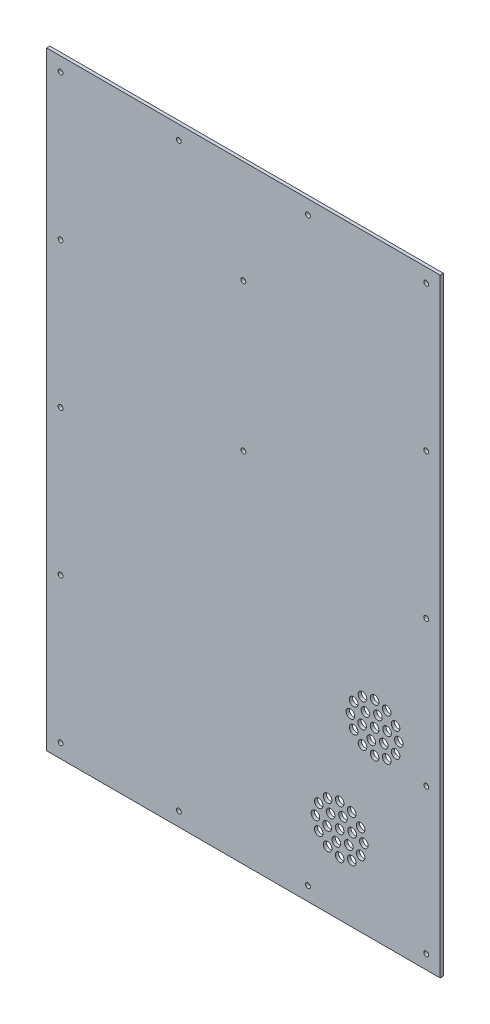
from build123d import *

# Parameters (mm, degrees)
SKETCH_1_W               = 366
SKETCH_1_H               = 566
EXTRUDE_1_DEPTH          = 3
SKETCH_5_R               = 2.25
CUT_EXTRUDE_2_DEPTH      = 675.033381963
CUT_EXTRUDE_5_DEPTH      = 675.033381963
CUT_EXTRUDE_5_DEPTH_BACK = 10
SKETCH_8_R               = 4
SKETCH_10_R              = 2.25
CUT_EXTRUDE_6_DEPTH      = 675.033381963


with BuildPart() as part:
    # Эскиз1 → Бобышка-Вытянуть1 (new body)
    with BuildSketch(Plane.XY):
        with Locations((183, 283)):
            Rectangle(SKETCH_1_W, SKETCH_1_H)
    extrude(amount=EXTRUDE_1_DEPTH)

    # Эскиз5 → Вырез-Вытянуть2 (cut, through all)
    with BuildSketch(Plane(origin=(0, 0, 0), x_dir=(-1, 0, 0), z_dir=(0, 0, -1))):
        with Locations((-353, 553)):
            Circle(SKETCH_5_R)
        with Locations((-13, 553)):
            Circle(SKETCH_5_R)
        with Locations((-243, 553)):
            Circle(SKETCH_5_R)
        with Locations((-123, 553)):
            Circle(SKETCH_5_R)
        with Locations((-353, 418)):
            Circle(SKETCH_5_R)
        with Locations((-353, 283)):
            Circle(SKETCH_5_R)
        with Locations((-353, 148)):
            Circle(SKETCH_5_R)
        with Locations((-353, 13)):
            Circle(SKETCH_5_R)
        with Locations((-123, 13)):
            Circle(SKETCH_5_R)
        with Locations((-243, 13)):
            Circle(SKETCH_5_R)
        with Locations((-13, 418)):
            Circle(SKETCH_5_R)
        with Locations((-13, 283)):
            Circle(SKETCH_5_R)
        with Locations((-13, 148)):
            Circle(SKETCH_5_R)
        with Locations((-13, 13)):
            Circle(SKETCH_5_R)
    extrude(amount=-CUT_EXTRUDE_2_DEPTH, mode=Mode.SUBTRACT)

    # Эскиз8 → Вырез-Вытянуть5 (cut, two sides: drawn at the far end of the back side and taken through both)
    with BuildSketch(Plane.XY.offset(-CUT_EXTRUDE_5_DEPTH_BACK)):
        with Locations((305, 148.5)):
            Circle(SKETCH_8_R)
        with Locations((313.485281374, 162.514718626)):
            Circle(SKETCH_8_R)
        with Locations((305, 171)):
            Circle(SKETCH_8_R)
        with Locations((293.75, 151.514428415)):
            Circle(SKETCH_8_R)
        with Locations((285.514428415, 159.75)):
            Circle(SKETCH_8_R)
        with Locations((282.5, 171)):
            Circle(SKETCH_8_R)
        with Locations((285.514428415, 182.25)):
            Circle(SKETCH_8_R)
        with Locations((293.75, 190.485571585)):
            Circle(SKETCH_8_R)
        with Locations((305, 193.5)):
            Circle(SKETCH_8_R)
        with Locations((316.25, 190.485571585)):
            Circle(SKETCH_8_R)
        with Locations((324.485571585, 182.25)):
            Circle(SKETCH_8_R)
        with Locations((327.5, 171)):
            Circle(SKETCH_8_R)
        with Locations((324.485571585, 159.75)):
            Circle(SKETCH_8_R)
        with Locations((316.25, 151.514428415)):
            Circle(SKETCH_8_R)
        with Locations((301.894171459, 159.408890085)):
            Circle(SKETCH_8_R)
        with Locations((293.408890085, 167.894171459)):
            Circle(SKETCH_8_R)
        with Locations((296.514718626, 179.485281374)):
            Circle(SKETCH_8_R)
        with Locations((308.105828541, 182.591109915)):
            Circle(SKETCH_8_R)
        with Locations((316.591109915, 174.105828541)):
            Circle(SKETCH_8_R)
        with Locations((272.5, 73)):
            Circle(SKETCH_8_R)
        with Locations((272.5, 50.5)):
            Circle(SKETCH_8_R)
        with Locations((280.985281374, 64.514718626)):
            Circle(SKETCH_8_R)
        with Locations((261.25, 53.514428415)):
            Circle(SKETCH_8_R)
        with Locations((253.014428415, 61.75)):
            Circle(SKETCH_8_R)
        with Locations((250, 73)):
            Circle(SKETCH_8_R)
        with Locations((253.014428415, 84.25)):
            Circle(SKETCH_8_R)
        with Locations((261.25, 92.485571585)):
            Circle(SKETCH_8_R)
        with Locations((272.5, 95.5)):
            Circle(SKETCH_8_R)
        with Locations((283.75, 92.485571585)):
            Circle(SKETCH_8_R)
        with Locations((291.985571585, 84.25)):
            Circle(SKETCH_8_R)
        with Locations((295, 73)):
            Circle(SKETCH_8_R)
        with Locations((291.985571585, 61.75)):
            Circle(SKETCH_8_R)
        with Locations((283.75, 53.514428415)):
            Circle(SKETCH_8_R)
        with Locations((269.394171459, 61.408890085)):
            Circle(SKETCH_8_R)
        with Locations((260.908890085, 69.894171459)):
            Circle(SKETCH_8_R)
        with Locations((264.014718626, 81.485281374)):
            Circle(SKETCH_8_R)
        with Locations((275.605828541, 84.591109915)):
            Circle(SKETCH_8_R)
        with Locations((284.091109915, 76.105828541)):
            Circle(SKETCH_8_R)
    extrude(amount=CUT_EXTRUDE_5_DEPTH + CUT_EXTRUDE_5_DEPTH_BACK, mode=Mode.SUBTRACT)

    # Эскиз10 → Вырез-Вытянуть6 (cut, through all)
    with BuildSketch(Plane.XY.offset(3)):
        with Locations((183, 470)):
            Circle(SKETCH_10_R)
        with Locations((183, 333)):
            Circle(SKETCH_10_R)
    extrude(amount=-CUT_EXTRUDE_6_DEPTH, mode=Mode.SUBTRACT)


solid = part.part
